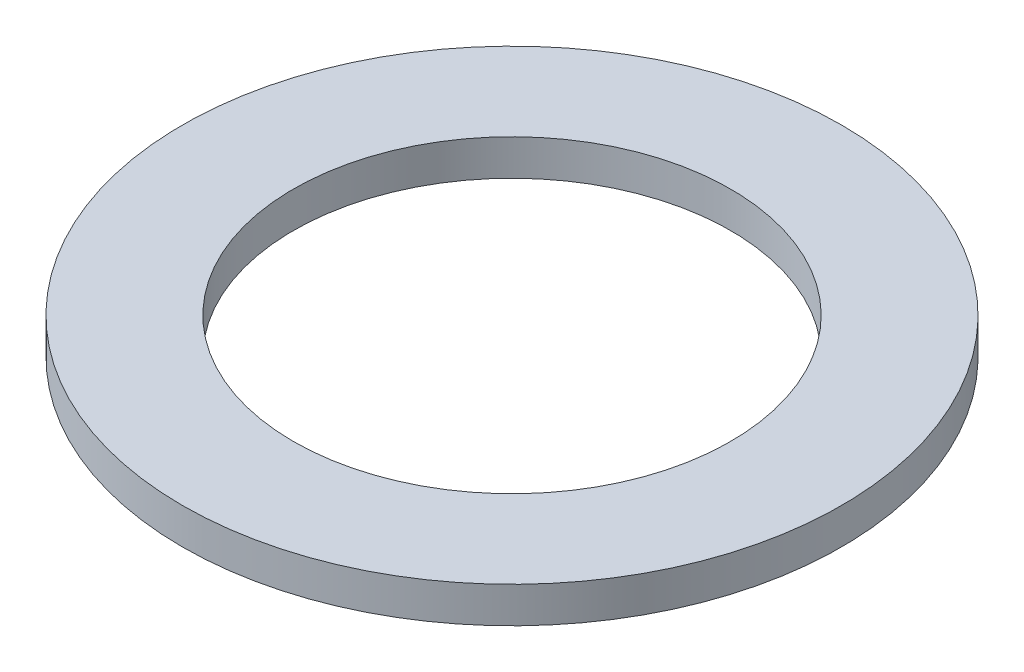
from build123d import *

# Parameters (mm, degrees)
SKETCH1_R           = 7.27458794
SKETCH1_R_2         = 4.826
BOSS_EXTRUDE1_DEPTH = 0.79375


with BuildPart() as part:
    # Sketch1 → Boss-Extrude1 (new body)
    with BuildSketch(Plane(origin=(0, 0, 0), x_dir=(1, 0, 0), z_dir=(0, 1, 0))):
        Circle(SKETCH1_R)
        Circle(SKETCH1_R_2, mode=Mode.SUBTRACT)
    extrude(amount=BOSS_EXTRUDE1_DEPTH)


solid = part.part
